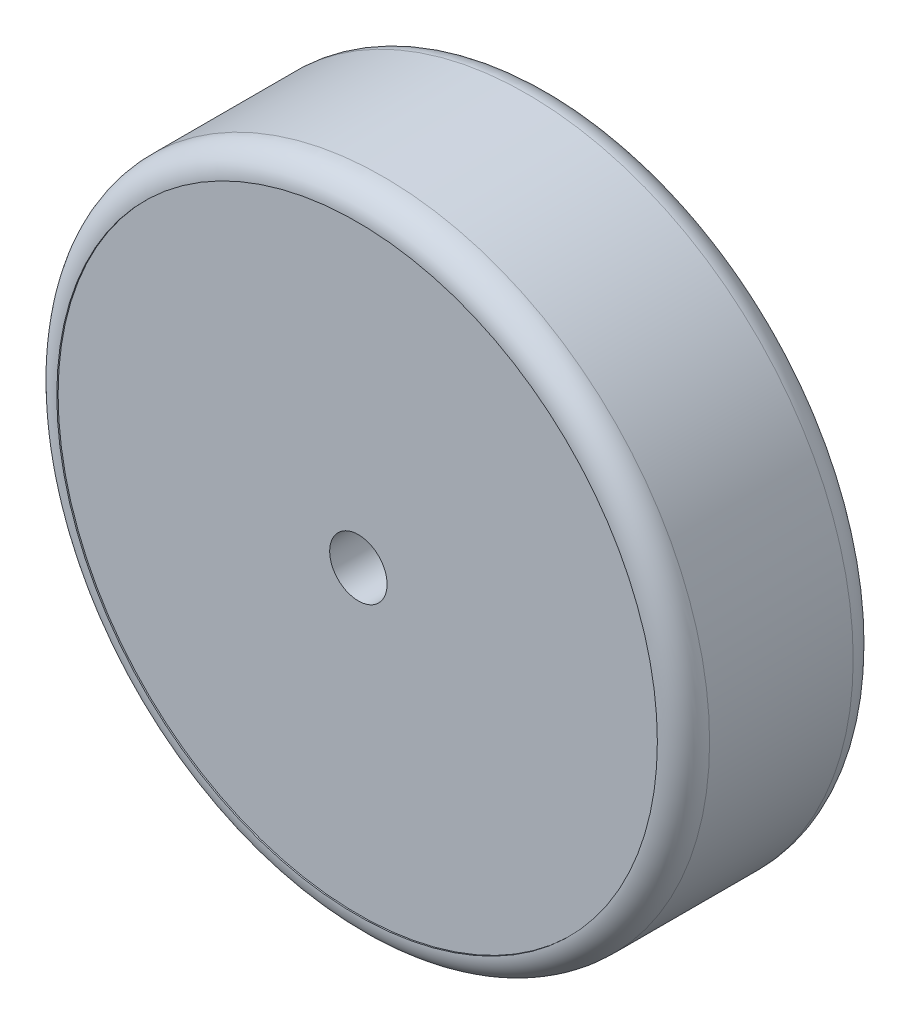
from build123d import *
from build123d.topology import SkipClean

# Parameters (mm, degrees)
SKETCH1_R               = 25
BOSS_EXTRUDE1_DEPTH     = 15
FILLET1_R               = 2
CUT_EXTRUDE2_DEPTH      = 39.405728804
CUT_EXTRUDE2_DEPTH_BACK = 39.405728804
SKETCH7_R               = 2.2
SKETCH8_R               = 23
CUT_EXTRUDE3_DEPTH      = 0.1
CUT_EXTRUDE4_START      = -0.1
SKETCH9_R               = 23
CUT_EXTRUDE4_DEPTH      = 0.1
BOSS_EXTRUDE3_START     = -0.1
SKETCH10_R              = 23
BOSS_EXTRUDE3_DEPTH     = 0.1
SKETCH11_R              = 2.2
CUT_EXTRUDE5_DEPTH      = 37.142080806
SKETCH12_R              = 23
BOSS_EXTRUDE4_DEPTH     = 0.1
SKETCH13_R              = 2.2
CUT_EXTRUDE6_DEPTH      = 39.366782573


with BuildPart() as part:
    # Sketch1 → Boss-Extrude1 (new body)
    with BuildSketch(Plane.XY):
        Circle(SKETCH1_R)
    extrude(amount=BOSS_EXTRUDE1_DEPTH)

    # Fillet1
    fillet1_edges = [part.edges().sort_by_distance(p)[0] for p in [
        (-25, 0, 15),
        (-25, 0, 0),
    ]]
    fillet(fillet1_edges, radius=FILLET1_R)

    # Sketch7 → Cut-Extrude2 (cut, two sides: drawn at the far end of the back side and taken through both)
    with BuildSketch(Plane.XY.offset(15).offset(-CUT_EXTRUDE2_DEPTH_BACK)):
        Circle(SKETCH7_R)
    extrude(amount=CUT_EXTRUDE2_DEPTH + CUT_EXTRUDE2_DEPTH_BACK, mode=Mode.SUBTRACT)

    # Sketch8 → Cut-Extrude3 (cut)
    with BuildSketch(Plane.XY.offset(15)):
        Circle(SKETCH8_R)
    extrude(amount=-CUT_EXTRUDE3_DEPTH, mode=Mode.SUBTRACT)

    # Sketch9 → Cut-Extrude4 (cut)
    with BuildSketch(Plane(origin=(0, 0, 0), x_dir=(-1, 0, 0), z_dir=(0, 0, -1)).offset(CUT_EXTRUDE4_START)):
        Circle(SKETCH9_R)
    extrude(amount=CUT_EXTRUDE4_DEPTH, mode=Mode.SUBTRACT)

    # Sketch10 → Boss-Extrude3 (add)
    with BuildSketch(Plane(origin=(0, 0, 0.1), x_dir=(-1, 0, 0), z_dir=(0, 0, -1)).offset(BOSS_EXTRUDE3_START)):
        Circle(SKETCH10_R)
    extrude(amount=BOSS_EXTRUDE3_DEPTH)

    # Sketch11 → Cut-Extrude5 (cut, through all)
    with SkipClean():  # the faces are left unmerged after this step: merging them gives an invalid solid
        with BuildSketch(Plane(origin=(0, 0, 7.5), x_dir=(-1, 0, 0), z_dir=(0, 0, -1))):
            Circle(SKETCH11_R)
        extrude(amount=CUT_EXTRUDE5_DEPTH, mode=Mode.SUBTRACT)

    # Sketch12 → Boss-Extrude4 (add)
    with SkipClean():  # the faces are left unmerged after this step: merging them gives an invalid solid
        with BuildSketch(Plane.XY.offset(14.9)):
            Circle(SKETCH12_R)
        extrude(amount=-BOSS_EXTRUDE4_DEPTH)

    # Sketch13 → Cut-Extrude6 (cut, through all)
    with SkipClean():  # the faces are left unmerged after this step: merging them gives an invalid solid
        with BuildSketch(Plane(origin=(0, 0, 0.1), x_dir=(-1, 0, 0), z_dir=(0, 0, -1))):
            Circle(SKETCH13_R)
        extrude(amount=-CUT_EXTRUDE6_DEPTH, mode=Mode.SUBTRACT)


solid = part.part
